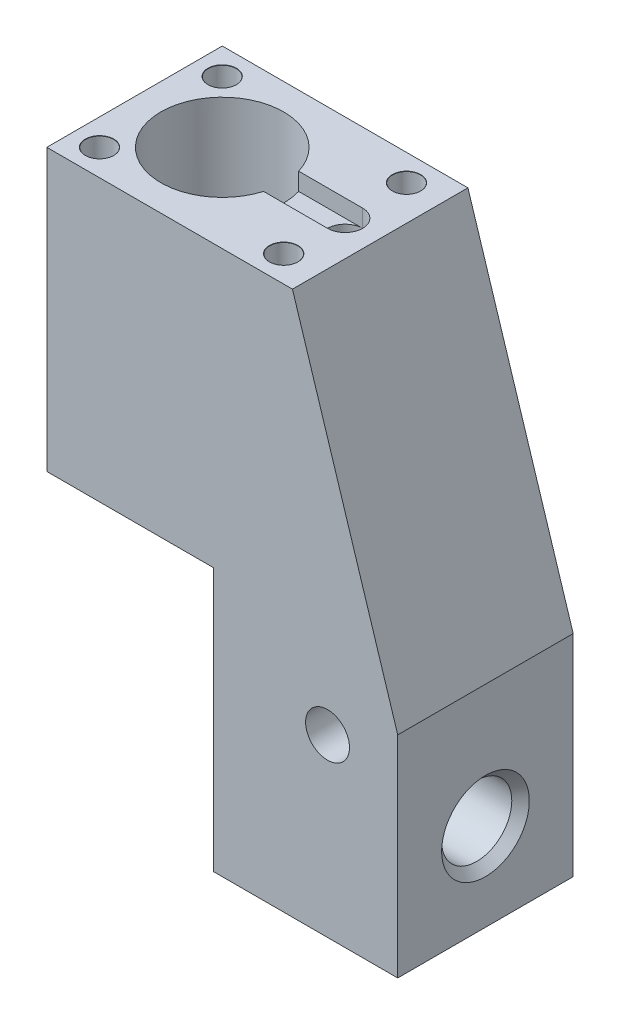
from build123d import *

# Parameters (mm, degrees)
SKETCH1_W                      = 21
SKETCH1_H                      = 20
BOSS_EXTRUDE2_DEPTH            = 62
CUT_EXTRUDE1_DEPTH             = 62
SKETCH4_W                      = 20
SKETCH4_H                      = 32
BOSS_EXTRUDE3_DEPTH            = 19
SKETCH7_R                      = 7
CUT_EXTRUDE2_DEPTH             = 47
SKETCH8_R                      = 4
CUT_EXTRUDE3_DEPTH             = 47
M3_CLEARANCE_HOLE1_D           = 3.2
M3_CLEARANCE_HOLE1_DEPTH       = 22.15862301
M3_CLEARANCE_HOLE1_CSINK_D     = 3.25
M3_CLEARANCE_HOLE1_CSINK_ANGLE = 90
M3_CLEARANCE_HOLE1_TIP         = 0.96137699
CUT_EXTRUDE7_DEPTH             = 72.513984646
CUT_EXTRUDE7_DEPTH_BACK        = 72.513984646
SKETCH14_R                     = 2.5
CHAMFER1_SIZE                  = 1
CUT_EXTRUDE8_DEPTH             = 2
HOLE1_D                        = 2.5
HOLE1_DEPTH                    = 100
SKETCH18_R                     = 2
CUT_EXTRUDE10_DEPTH            = 30
SKETCH19_R                     = 1.6
CUT_EXTRUDE11_DEPTH            = 13
CUT_EXTRUDE12_REACH            = 71.385
CUT_EXTRUDE12_END_RADIUS       = 2.5
SKETCH24_R                     = 1.65


with BuildPart() as part:
    # Sketch1 → Boss-Extrude2 (new body)
    with BuildSketch(Plane(origin=(0, 0, 0), x_dir=(1, 0, 0), z_dir=(0, 1, 0))):
        Rectangle(SKETCH1_W, SKETCH1_H)
    extrude(amount=BOSS_EXTRUDE2_DEPTH)

    # Sketch3 → Cut-Extrude1 (cut)
    with BuildSketch(Plane.XY.offset(10)):
        Polygon((10.5, 62), (-1.5, 62), (10.5, 24), align=None)
    extrude(amount=-CUT_EXTRUDE1_DEPTH, mode=Mode.SUBTRACT)

    # Sketch4 → Boss-Extrude3 (add)
    with BuildSketch(Plane.ZY.offset(10.5)):
        with Locations((0, 46)):
            Rectangle(SKETCH4_W, SKETCH4_H)
    extrude(amount=BOSS_EXTRUDE3_DEPTH)

    # Sketch7 → Cut-Extrude2 (cut)
    with BuildSketch(Plane(origin=(0, 62, 0), x_dir=(1, 0, 0), z_dir=(0, 1, 0))):
        with Locations(Location((-19.5, 0, 0), (0, 0, 270))):
            Circle(SKETCH7_R)
    extrude(amount=-CUT_EXTRUDE2_DEPTH, mode=Mode.SUBTRACT)

    # Sketch8 → Cut-Extrude3 (cut)
    with BuildSketch(Plane(origin=(10.5, 0, 0), x_dir=(0, 0, -1), z_dir=(1, 0, 0))):
        with Locations((0, 10)):
            Circle(SKETCH8_R)
    extrude(amount=-CUT_EXTRUDE3_DEPTH, mode=Mode.SUBTRACT)

    # M3 Clearance Hole1
    with Locations(Plane(origin=(0, 62, 0), x_dir=(1, 0, 0), z_dir=(0, 1, 0))):
        with Locations((-26.5, 6.988952109), (-26.5, -6.988952109), (-5.5, -7), (-5.5, 7)):
            CounterSinkHole(M3_CLEARANCE_HOLE1_D / 2, M3_CLEARANCE_HOLE1_CSINK_D / 2, depth=M3_CLEARANCE_HOLE1_DEPTH, counter_sink_angle=M3_CLEARANCE_HOLE1_CSINK_ANGLE)
            with Locations((0, 0, -(M3_CLEARANCE_HOLE1_DEPTH + M3_CLEARANCE_HOLE1_TIP / 2))):  # 118° drill point
                Cone(0, M3_CLEARANCE_HOLE1_D / 2, M3_CLEARANCE_HOLE1_TIP, mode=Mode.SUBTRACT)

    # Sketch14 → Cut-Extrude7 (cut, two sides: drawn at the far end of the back side and taken through both)
    with BuildSketch(Plane.XY.offset(10).offset(-CUT_EXTRUDE7_DEPTH_BACK)):
        with Locations((2.5, 20)):
            Circle(SKETCH14_R)
    extrude(amount=CUT_EXTRUDE7_DEPTH + CUT_EXTRUDE7_DEPTH_BACK, mode=Mode.SUBTRACT)

    # Chamfer1
    chamfer1_edges = [part.edges().sort_by_distance(p)[0] for p in [
        (10.5, 10, 4),
    ]]
    chamfer(chamfer1_edges, length=CHAMFER1_SIZE)

    # Sketch15 → Cut-Extrude8 (cut)
    with BuildSketch(Plane(origin=(0, 62, 0), x_dir=(1, 0, 0), z_dir=(0, 1, 0))):
        with BuildLine():
            Line((-5.5, 2), (-14.947436463, 2))
            Line((-14.947436463, 2), (-14.947436463, -2))
            Line((-14.947436463, -2), (-5.5, -2))
            ThreePointArc((-5.5, -2), (-3.5, 0), (-5.5, 2))
        make_face()
    extrude(amount=-CUT_EXTRUDE8_DEPTH, mode=Mode.SUBTRACT)

    # Hole1
    with Locations(Plane(origin=(0, 60, 0), x_dir=(1, 0, 0), z_dir=(0, 1, 0))):
        with Locations((-5.231662338, 0)):
            Hole(HOLE1_D / 2, depth=HOLE1_DEPTH)

    # Sketch18 → Cut-Extrude10 (cut)
    with BuildSketch(Plane(origin=(0, 60, 0), x_dir=(1, 0, 0), z_dir=(0, 1, 0))):
        with Locations(Location((-5.5, 0, 0), (0, 0, 270))):
            Circle(SKETCH18_R)
    extrude(amount=-CUT_EXTRUDE10_DEPTH, mode=Mode.SUBTRACT)

    # Sketch19 → Cut-Extrude11 (cut)
    with BuildSketch(Plane.ZY.offset(29.5)):
        with Locations((-3, 46)):
            Circle(SKETCH19_R)
        with Locations((3, 46)):
            Circle(SKETCH19_R)
    extrude(amount=-CUT_EXTRUDE11_DEPTH, mode=Mode.SUBTRACT)

    # M4 Tapped Hole1: read off the stored shape, not the designer's step
    # M4 Tapped Hole1: loft between two sections, ruled curve by curve
    m4_tapped_hole1_from = [
        Edge.make_three_point_arc((-5.5, 6.356330866, -1.65), (-3.85, 6.356330866, 0), (-5.5, 6.356330866, 1.65)),
        Edge.make_three_point_arc((-5.5, 6.356330866, 1.65), (-7.15, 6.356330866, 0), (-5.5, 6.356330866, -1.65)),
    ]
    m4_tapped_hole1_to = [
        Edge.make_three_point_arc((-5.5, 0, -1.65), (-3.85, 0, 0), (-5.5, 0, 1.65)),
        Edge.make_three_point_arc((-5.5, 0, 1.65), (-7.15, 0, 0), (-5.5, 0, -1.65)),
    ]
    m4_tapped_hole1 = Solid(Shell([*[Face.make_surface_from_curves(m4_tapped_hole1_from[k], m4_tapped_hole1_to[k]) for k in range(2)], Face(Wire(m4_tapped_hole1_from)), Face(Wire(m4_tapped_hole1_to))]))
    add(m4_tapped_hole1, mode=Mode.SUBTRACT)

    # M4 Tapped Hole1 2: loft between two sections, ruled curve by curve
    m4_tapped_hole1_2_from = [
        Edge.make_three_point_arc((-5.5, 30, -1.65), (-3.85, 30, 0), (-5.5, 30, 1.65)),
        Edge.make_three_point_arc((-5.5, 30, 1.65), (-7.15, 30, 0), (-5.5, 30, -1.65)),
    ]
    m4_tapped_hole1_2_to = [
        Edge.make_three_point_arc((-5.5, 13.643669134, -1.65), (-3.85, 13.643669134, 0), (-5.5, 13.643669134, 1.65)),
        Edge.make_three_point_arc((-5.5, 13.643669134, 1.65), (-7.15, 13.643669134, 0), (-5.5, 13.643669134, -1.65)),
    ]
    m4_tapped_hole1_2 = Solid(Shell([*[Face.make_surface_from_curves(m4_tapped_hole1_2_from[k], m4_tapped_hole1_2_to[k]) for k in range(2)], Face(Wire(m4_tapped_hole1_2_from)), Face(Wire(m4_tapped_hole1_2_to))]))
    add(m4_tapped_hole1_2, mode=Mode.SUBTRACT)

    # M4 Tapped Hole1 3: loft between two sections, ruled curve by curve
    m4_tapped_hole1_3_from = [
        Edge.make_three_point_arc((2.5, 6.356330866, -1.65), (4.15, 6.356330866, 0), (2.5, 6.356330866, 1.65)),
        Edge.make_three_point_arc((2.5, 6.356330866, 1.65), (0.85, 6.356330866, 0), (2.5, 6.356330866, -1.65)),
    ]
    m4_tapped_hole1_3_to = [
        Edge.make_three_point_arc((2.5, 0, -1.65), (4.15, 0, 0), (2.5, 0, 1.65)),
        Edge.make_three_point_arc((2.5, 0, 1.65), (0.85, 0, 0), (2.5, 0, -1.65)),
    ]
    m4_tapped_hole1_3 = Solid(Shell([*[Face.make_surface_from_curves(m4_tapped_hole1_3_from[k], m4_tapped_hole1_3_to[k]) for k in range(2)], Face(Wire(m4_tapped_hole1_3_from)), Face(Wire(m4_tapped_hole1_3_to))]))
    add(m4_tapped_hole1_3, mode=Mode.SUBTRACT)

    # Cut-Extrude12: up to this cylinder (the profile starts outside it)
    cut_extrude12_end = Plane(origin=(2.5, 20, 0), z_dir=(0, 0, 1)) * Cylinder(CUT_EXTRUDE12_END_RADIUS, 148.77, mode=Mode.PRIVATE)
    # Sketch24 → Cut-Extrude12 (cut, up to the surface)
    with BuildSketch(Plane.XZ, mode=Mode.PRIVATE) as cut_extrude12_sk1:
        with Locations(Location((2.5, 0, 0), (0, 0, 270))):
            Circle(SKETCH24_R)
    cut_extrude12_tool1 = extrude(cut_extrude12_sk1.sketch, amount=-CUT_EXTRUDE12_REACH, mode=Mode.PRIVATE) - cut_extrude12_end
    add(cut_extrude12_tool1.solids().sort_by_distance((2.5, 0, 0))[0], mode=Mode.SUBTRACT)


solid = part.part
